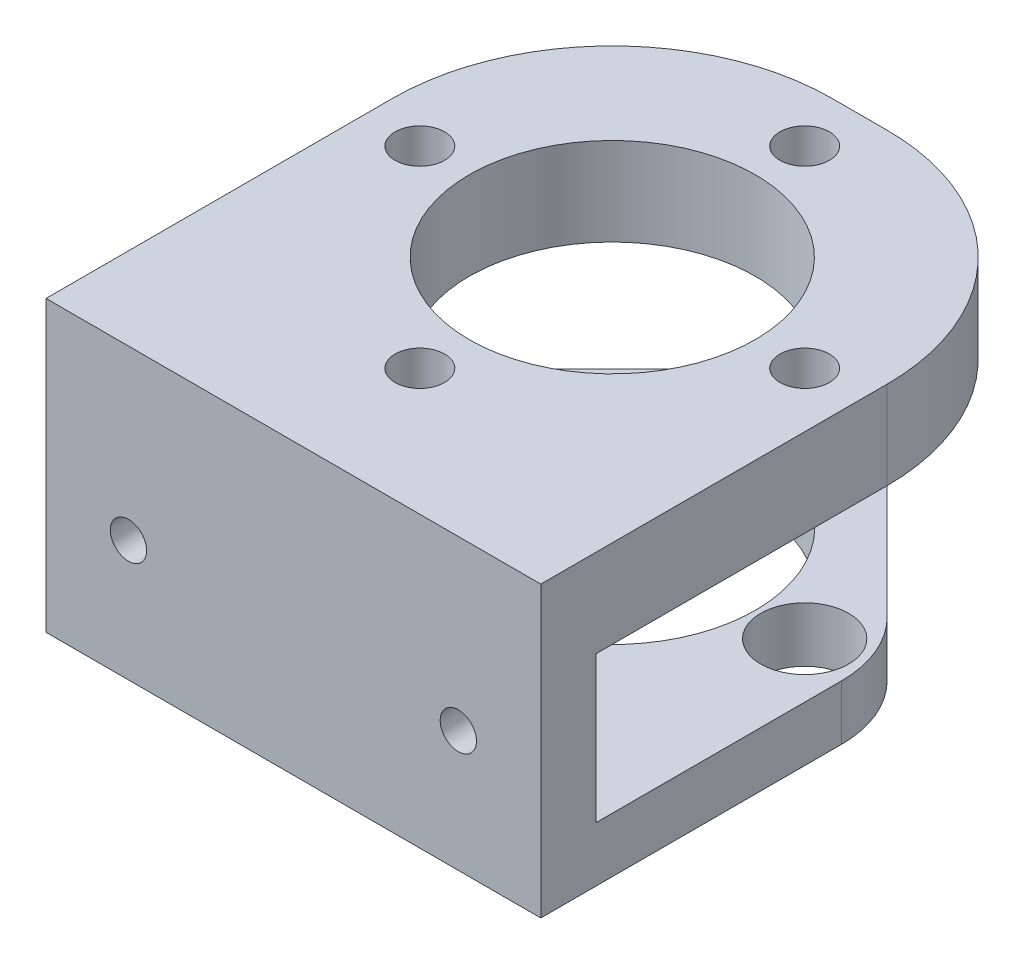
from build123d import *

# Parameters (mm, degrees)
SKETCH_1_W               = 45
SKETCH_1_H               = 45
SKETCH_1_R               = 13
EXTRUDE_1_DEPTH          = 8
FILLET_1_R               = 20
SKETCH_2_W               = 45
SKETCH_2_H               = 8
EXTRUDE_2_DEPTH          = 6.5
PATTERN_CIRCULAR_1_COUNT = 4
SKETCH_7_W               = 45
SKETCH_7_H               = 5
EXTRUDE_3_DEPTH          = 13.3
SKETCH_9_W               = 45
SKETCH_9_H               = 5
EXTRUDE_4_DEPTH          = 51.5
SKETCH_10_R              = 13.025
CUT_EXTRUDE_1_DEPTH      = 53.3
CUT_EXTRUDE_2_REACH      = 47.155
SKETCH_11_R              = 4
HOLE_WIZARD_M4_1_2_D     = 3.3
HOLE_WIZARD_M4_1_2_DEPTH = 11.5
HOLE_WIZARD_M4_1_2_TIP   = 0.991420021
CUT_EXTRUDE_3_REACH      = 47.155
FILLET_4_R               = 10


with BuildPart() as part:
    # 草图1 → 凸台-拉伸1 (new body)
    with BuildSketch(Plane(origin=(0, 0, 0), x_dir=(1, 0, 0), z_dir=(0, 1, 0))):
        Rectangle(SKETCH_1_W, SKETCH_1_H)
        with Locations(Location((0, 0, 0), (0, 0, 270))):
            Circle(SKETCH_1_R, mode=Mode.SUBTRACT)
    extrude(amount=EXTRUDE_1_DEPTH)

    # 圆角1
    fillet_1_edges = [part.edges().sort_by_distance(p)[0] for p in [
        (-22.5, 4, -22.5),
        (22.5, 4, -22.5),
    ]]
    fillet(fillet_1_edges, radius=FILLET_1_R)

    # 草图2 → 凸台-拉伸2 (add)
    with BuildSketch(Plane.XY.offset(22.5)):
        with Locations((0, 4)):
            Rectangle(SKETCH_2_W, SKETCH_2_H)
    extrude(amount=EXTRUDE_2_DEPTH)

    # 草图6 → Hole Wizard M4 _1 (revolve, cut)
    with BuildSketch(Plane(origin=(0, 0, 17.5), x_dir=(0, 0, -1), z_dir=(1, 0, 0))):
        Polygon((0, 0), (0, 21.351936393), (2.25, 20), (2.25, 4.4), (4, 4.4), (4, 0), align=None)
    hole_wizard_m4_1 = revolve(axis=Axis((0, -6.35, 17.5), (0, 1, 0)), mode=Mode.SUBTRACT)

    # 阵列(圆周)1: Hole Wizard M4 _1 ×4 about axis
    pattern_circular_1_axis = Axis((0, 0, 0), (0, 1, 0))
    for i in range(1, PATTERN_CIRCULAR_1_COUNT):
        add(hole_wizard_m4_1.rotate(pattern_circular_1_axis, i * 360 / PATTERN_CIRCULAR_1_COUNT), mode=Mode.SUBTRACT)

    # 草图7 → 凸台-拉伸3 (add)
    with BuildSketch(Plane.XZ):
        with Locations((0, 26.5)):
            Rectangle(SKETCH_7_W, SKETCH_7_H)
    extrude(amount=EXTRUDE_3_DEPTH)

    # 草图9 → 凸台-拉伸4 (add)
    with BuildSketch(Plane.XY.offset(29)):
        with Locations((0, -15.8)):
            Rectangle(SKETCH_9_W, SKETCH_9_H)
    extrude(amount=-EXTRUDE_4_DEPTH)

    # 草图10 → 切除-拉伸1 (cut)
    with BuildSketch(Plane(origin=(0, -13.3, 0), x_dir=(1, 0, 0), z_dir=(0, 1, 0))):
        with Locations(Location((0, 0, 0), (0, 0, 270))):
            Circle(SKETCH_10_R)
    extrude(amount=-CUT_EXTRUDE_1_DEPTH, mode=Mode.SUBTRACT)

    # 草图11 → 切除-拉伸2 (cut, up to next)
    with BuildSketch(Plane(origin=(0, -18.3, 0), x_dir=(-1, 0, 0), z_dir=(0, -1, 0)), mode=Mode.PRIVATE) as cut_extrude_2_sk1:
        with Locations(Location((0, -17.5, 0), (0, 0, 90))):
            Circle(SKETCH_11_R)
    cut_extrude_2_tool1 = extrude(cut_extrude_2_sk1.sketch, amount=-CUT_EXTRUDE_2_REACH, mode=Mode.PRIVATE) & part.part
    # 草图11 → 切除-拉伸2 (cut, up to next)
    with BuildSketch(Plane(origin=(0, -18.3, 0), x_dir=(-1, 0, 0), z_dir=(0, -1, 0)), mode=Mode.PRIVATE) as cut_extrude_2_sk2:
        with Locations(Location((-17.5, 0, 0), (0, 0, 90))):
            Circle(SKETCH_11_R)
    cut_extrude_2_tool2 = extrude(cut_extrude_2_sk2.sketch, amount=-CUT_EXTRUDE_2_REACH, mode=Mode.PRIVATE) & part.part
    # 草图11 → 切除-拉伸2 (cut, up to next)
    with BuildSketch(Plane(origin=(0, -18.3, 0), x_dir=(-1, 0, 0), z_dir=(0, -1, 0)), mode=Mode.PRIVATE) as cut_extrude_2_sk3:
        with Locations(Location((0, 17.5, 0), (0, 0, 90))):
            Circle(SKETCH_11_R)
    cut_extrude_2_tool3 = extrude(cut_extrude_2_sk3.sketch, amount=-CUT_EXTRUDE_2_REACH, mode=Mode.PRIVATE) & part.part
    # 草图11 → 切除-拉伸2 (cut, up to next)
    with BuildSketch(Plane(origin=(0, -18.3, 0), x_dir=(-1, 0, 0), z_dir=(0, -1, 0)), mode=Mode.PRIVATE) as cut_extrude_2_sk4:
        with Locations(Location((17.5, 0, 0), (0, 0, 90))):
            Circle(SKETCH_11_R)
    cut_extrude_2_tool4 = extrude(cut_extrude_2_sk4.sketch, amount=-CUT_EXTRUDE_2_REACH, mode=Mode.PRIVATE) & part.part
    add(cut_extrude_2_tool1.solids().sort_by_distance((0, -18.3, 17.5))[0], mode=Mode.SUBTRACT)
    add(cut_extrude_2_tool2.solids().sort_by_distance((17.5, -18.3, 0))[0], mode=Mode.SUBTRACT)
    add(cut_extrude_2_tool3.solids().sort_by_distance((0, -18.3, -17.5))[0], mode=Mode.SUBTRACT)
    add(cut_extrude_2_tool4.solids().sort_by_distance((-17.5, -18.3, 0))[0], mode=Mode.SUBTRACT)

    # Hole Wizard M4 _1 2
    with Locations(Plane(origin=(15, -7.3, 24), x_dir=(-1, 0, 0), z_dir=(0, 0, -1))):
        with Locations((0, 0), (30, 0)):
            Hole(HOLE_WIZARD_M4_1_2_D / 2, depth=HOLE_WIZARD_M4_1_2_DEPTH)
            with Locations((0, 0, -(HOLE_WIZARD_M4_1_2_DEPTH + HOLE_WIZARD_M4_1_2_TIP / 2))):  # 118° drill point
                Cone(0, HOLE_WIZARD_M4_1_2_D / 2, HOLE_WIZARD_M4_1_2_TIP, mode=Mode.SUBTRACT)

    # 草图23 → 切除-拉伸3 (cut, up to next)
    with BuildSketch(Plane.XZ.offset(18.3), mode=Mode.PRIVATE) as cut_extrude_3_sk1:
        Polygon((-22.5, -2.5), (-2.5, -22.5), (-22.5, -22.5), align=None)
    cut_extrude_3_tool1 = extrude(cut_extrude_3_sk1.sketch, amount=-CUT_EXTRUDE_3_REACH, mode=Mode.PRIVATE) & part.part
    # 草图23 → 切除-拉伸3 (cut, up to next)
    with BuildSketch(Plane.XZ.offset(18.3), mode=Mode.PRIVATE) as cut_extrude_3_sk2:
        Polygon((22.5, -22.5), (22.5, -2.5), (2.5, -22.5), align=None)
    cut_extrude_3_tool2 = extrude(cut_extrude_3_sk2.sketch, amount=-CUT_EXTRUDE_3_REACH, mode=Mode.PRIVATE) & part.part
    add(cut_extrude_3_tool1.solids().sort_by_distance((-15.833333, -18.3, -15.833333))[0], mode=Mode.SUBTRACT)
    add(cut_extrude_3_tool2.solids().sort_by_distance((15.833333, -18.3, -15.833333))[0], mode=Mode.SUBTRACT)

    # 圆角4
    # the kernel refuses this fillet: 10 mm, written as the material it takes off along each edge
    with BuildSketch(Plane(origin=(-22.5, -28.655339059, -2.5), x_dir=(0, 0, 1), z_dir=(0, 1, 0)), Plane(origin=(-2.5, -28.655339059, -22.5), x_dir=(-0.7071067811865476, 0, 0.7071067811865476), z_dir=(0, 1, 0))) as fillet_4_piece_1:
        with BuildLine():
            CenterArc((FILLET_4_R * 0.414213562373, FILLET_4_R), FILLET_4_R, 225, 45)
            Line((-FILLET_4_R * 0.292893218813, FILLET_4_R * 0.292893218813), (0, 0))
            Line((0, 0), (FILLET_4_R * 0.414213562373, 0))
        make_face()
    extrude(amount=25.710678119, mode=Mode.SUBTRACT)
    with BuildSketch(Plane(origin=(22.5, -28.655339059, -2.5), x_dir=(0, 0, 1), z_dir=(0, 1, 0)), Plane(origin=(2.5, -28.655339059, -22.5), x_dir=(0.7071067811865476, 0, 0.7071067811865476), z_dir=(0, 1, 0))) as fillet_4_piece_2:
        with BuildLine():
            CenterArc((FILLET_4_R * 0.414213562373, -FILLET_4_R), FILLET_4_R, 90, 45)
            Line((-FILLET_4_R * 0.292893218813, -FILLET_4_R * 0.292893218813), (0, 0))
            Line((0, 0), (FILLET_4_R * 0.414213562373, 0))
        make_face()
    extrude(amount=25.710678119, mode=Mode.SUBTRACT)


solid = part.part
